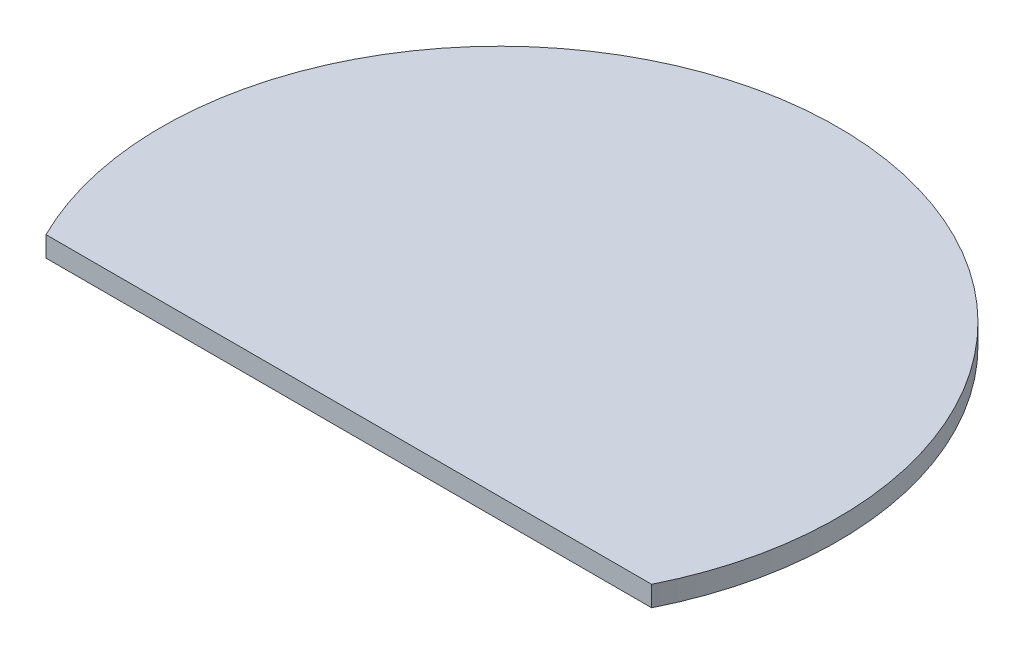
from build123d import *

# Parameters (mm, degrees)
BOSS_EXTRUDE1_DEPTH = 1


with BuildPart() as part:
    # Sketch1 → Boss-Extrude1 (new body)
    with BuildSketch(Plane(origin=(0, 0, 0), x_dir=(1, 0, 0), z_dir=(0, 1, 0))):
        with BuildLine():
            Line((-14.859340497, -7.4), (14.859340497, -7.4))
            ThreePointArc((14.859340497, -7.4), (0, 16.6), (-14.859340497, -7.4))
        make_face()
    extrude(amount=BOSS_EXTRUDE1_DEPTH)


solid = part.part
